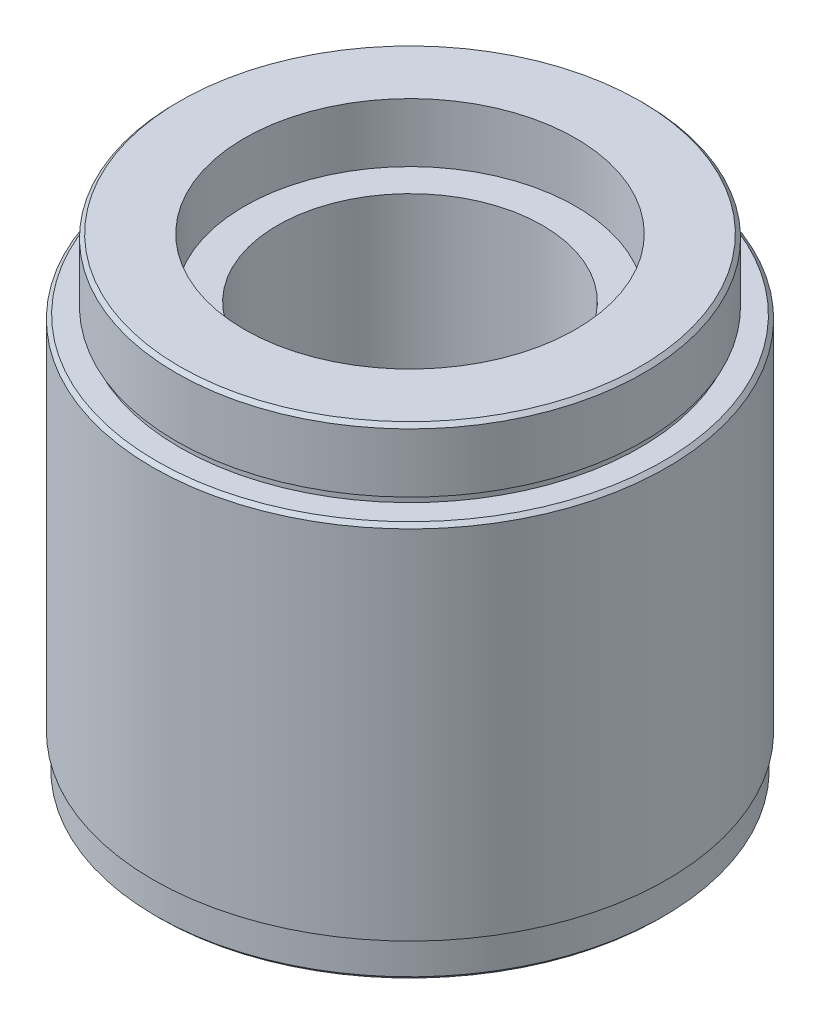
from build123d import *

# Parameters (mm, degrees)
SKETCH1_R                      = 34.925
MAIN_BODY_DEPTH                = 63.5
SKETCH2_OUTSIDE_W              = 95.336
SKETCH2_OUTSIDE_H              = 95.336
SKETCH2_OUTSIDE_R              = 34.5
BOTTOM_STEP_DEPTH              = 5
SKETCH3_OUTSIDE_W              = 95.336
SKETCH3_OUTSIDE_H              = 95.336
SKETCH3_OUTSIDE_R              = 31.75
TOP_DIAMETER_DEPTH             = 9.52
SKETCH4_OUTSIDE_W              = 95.336
SKETCH4_OUTSIDE_H              = 95.336
SKETCH4_OUTSIDE_R              = 31.25
CUT_EXTRUDE3_DEPTH             = 1
SKETCH5_R                      = 22.5
INSERT_BORE_DEPTH              = 8
SKETCH6_R                      = 18
CUT_EXTRUDE5_DEPTH             = 81.447257567
SKETCH7_R                      = 21
CUT_EXTRUDE6_DEPTH             = 5
BOTTOM_EDGE_CHAMFER_SIZE       = 0.5
BOTTOM_EDGE_CHAMFER_SIZE2      = 0.499999887
TOP_FACE_CHAMFER_SIZE          = 0.5
TOP_FACE_CHAMFER_SIZE2         = 0.499999887
BODY_TO_TOP_FACE_CHAMFER_SIZE  = 0.5
BODY_TO_TOP_FACE_CHAMFER_SIZE2 = 0.499999887


with BuildPart() as part:
    # Sketch1 → Main Body (new body)
    with BuildSketch(Plane(origin=(0, 0, 0), x_dir=(1, 0, 0), z_dir=(0, 1, 0))):
        Circle(SKETCH1_R)
    extrude(amount=MAIN_BODY_DEPTH)

    # Sketch2 outside → Bottom Step (cut)
    with BuildSketch(Plane.XZ):
        Rectangle(SKETCH2_OUTSIDE_W, SKETCH2_OUTSIDE_H)
        Circle(SKETCH2_OUTSIDE_R, mode=Mode.SUBTRACT)
    extrude(amount=-BOTTOM_STEP_DEPTH, mode=Mode.SUBTRACT)

    # Sketch3 outside → Top Diameter (cut)
    with BuildSketch(Plane(origin=(0, 63.5, 0), x_dir=(1, 0, 0), z_dir=(0, 1, 0))):
        Rectangle(SKETCH3_OUTSIDE_W, SKETCH3_OUTSIDE_H)
        Circle(SKETCH3_OUTSIDE_R, mode=Mode.SUBTRACT)
    extrude(amount=-TOP_DIAMETER_DEPTH, mode=Mode.SUBTRACT)

    # Sketch4 outside → Cut-Extrude3 (cut)
    with BuildSketch(Plane(origin=(0, 53.98, 0), x_dir=(1, 0, 0), z_dir=(0, 1, 0))):
        Rectangle(SKETCH4_OUTSIDE_W, SKETCH4_OUTSIDE_H)
        Circle(SKETCH4_OUTSIDE_R, mode=Mode.SUBTRACT)
    extrude(amount=CUT_EXTRUDE3_DEPTH, mode=Mode.SUBTRACT)

    # Sketch5 → Insert Bore (cut)
    with BuildSketch(Plane(origin=(0, 63.5, 0), x_dir=(1, 0, 0), z_dir=(0, 1, 0))):
        Circle(SKETCH5_R)
    extrude(amount=-INSERT_BORE_DEPTH, mode=Mode.SUBTRACT)

    # Sketch6 → Cut-Extrude5 (cut, through all)
    with BuildSketch(Plane.XZ):
        Circle(SKETCH6_R)
    extrude(amount=-CUT_EXTRUDE5_DEPTH, mode=Mode.SUBTRACT)

    # Sketch7 → Cut-Extrude6 (cut)
    with BuildSketch(Plane.XZ):
        Circle(SKETCH7_R)
    extrude(amount=-CUT_EXTRUDE6_DEPTH, mode=Mode.SUBTRACT)

    # Bottom Edge Chamfer
    bottom_edge_chamfer_edges = [part.edges().sort_by_distance(p)[0] for p in [
        (-34.5, 0, 0),
    ]]
    bottom_edge_chamfer_side = [part.faces().sort_by_distance(p)[0] for p in [
        (-33.524192642, 0, 0),
    ]]
    chamfer(bottom_edge_chamfer_edges, length=BOTTOM_EDGE_CHAMFER_SIZE, length2=BOTTOM_EDGE_CHAMFER_SIZE2, reference=bottom_edge_chamfer_side[0])

    # Top Face Chamfer
    top_face_chamfer_edges = [part.edges().sort_by_distance(p)[0] for p in [
        (-31.75, 63.5, 0),
    ]]
    top_face_chamfer_side = [part.faces().sort_by_distance(p)[0] for p in [
        (-30.851974388, 63.5, 0),
    ]]
    chamfer(top_face_chamfer_edges, length=TOP_FACE_CHAMFER_SIZE, length2=TOP_FACE_CHAMFER_SIZE2, reference=top_face_chamfer_side[0])

    # Body To Top Face Chamfer
    body_to_top_face_chamfer_edges = [part.edges().sort_by_distance(p)[0] for p in [
        (-34.925, 53.98, 0),
    ]]
    body_to_top_face_chamfer_side = [part.faces().sort_by_distance(p)[0] for p in [
        (-33.937171827, 53.98, 0),
    ]]
    chamfer(body_to_top_face_chamfer_edges, length=BODY_TO_TOP_FACE_CHAMFER_SIZE, length2=BODY_TO_TOP_FACE_CHAMFER_SIZE2, reference=body_to_top_face_chamfer_side[0])


solid = part.part
